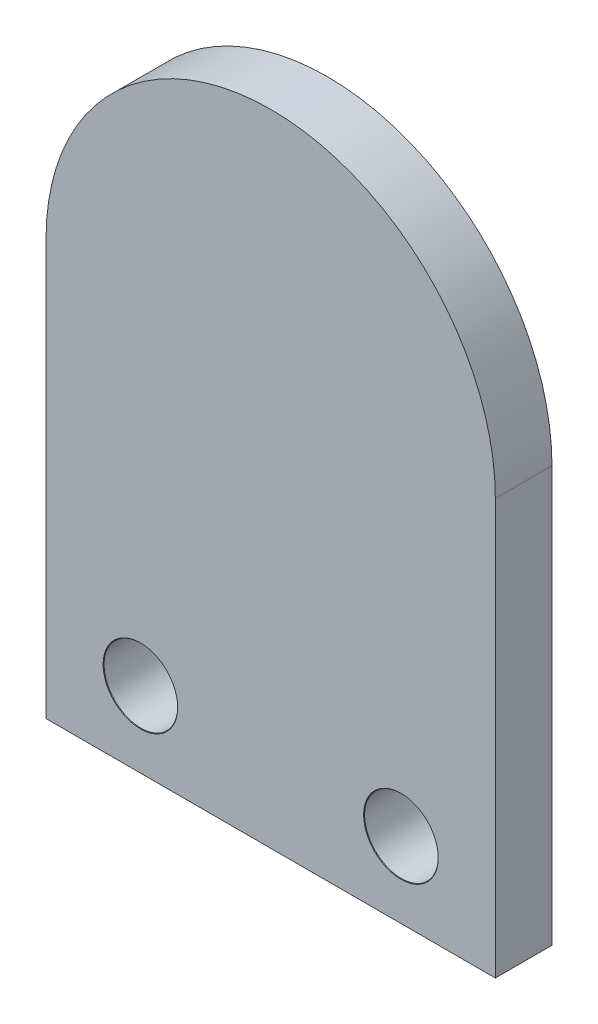
from build123d import *

# Parameters (mm, degrees)
BOSS_EXTRUDE1_DEPTH              = 3
SKETCH2_R                        = 1.95
BOSS_EXTRUDE2_DEPTH              = 3
M3_5_CLEARANCE_HOLE1_D           = 3.9
M3_5_CLEARANCE_HOLE1_CSINK_D     = 3.95
M3_5_CLEARANCE_HOLE1_CSINK_ANGLE = 90


with BuildPart() as part:
    # Sketch1 → Boss-Extrude1 (new body)
    with BuildSketch(Plane.XY):
        with BuildLine():
            Line((-11.9, 0), (-11.9, -22))
            Line((-11.9, -22), (11.9, -22))
            Line((11.9, -22), (11.9, 0))
            ThreePointArc((11.9, 0), (0, 11.9), (-11.9, 0))
        make_face()
    extrude(amount=BOSS_EXTRUDE1_DEPTH)

    # Sketch2 → Boss-Extrude2 (add)
    with BuildSketch(Plane(origin=(0, 0, 0), x_dir=(-1, 0, 0), z_dir=(0, 0, -1))):
        with Locations((0, 6)):
            Circle(SKETCH2_R)
        with Locations((6, 0)):
            Circle(SKETCH2_R)
        with Locations((0, -6)):
            Circle(SKETCH2_R)
        with Locations((-6, 0)):
            Circle(SKETCH2_R)
    extrude(amount=BOSS_EXTRUDE2_DEPTH)

    # M3.5 Clearance Hole1 (through all)
    with Locations(Plane.XY.offset(3)):
        with Locations((6.9, -18), (-6.9, -18)):
            CounterSinkHole(M3_5_CLEARANCE_HOLE1_D / 2, M3_5_CLEARANCE_HOLE1_CSINK_D / 2, counter_sink_angle=M3_5_CLEARANCE_HOLE1_CSINK_ANGLE)


solid = part.part
